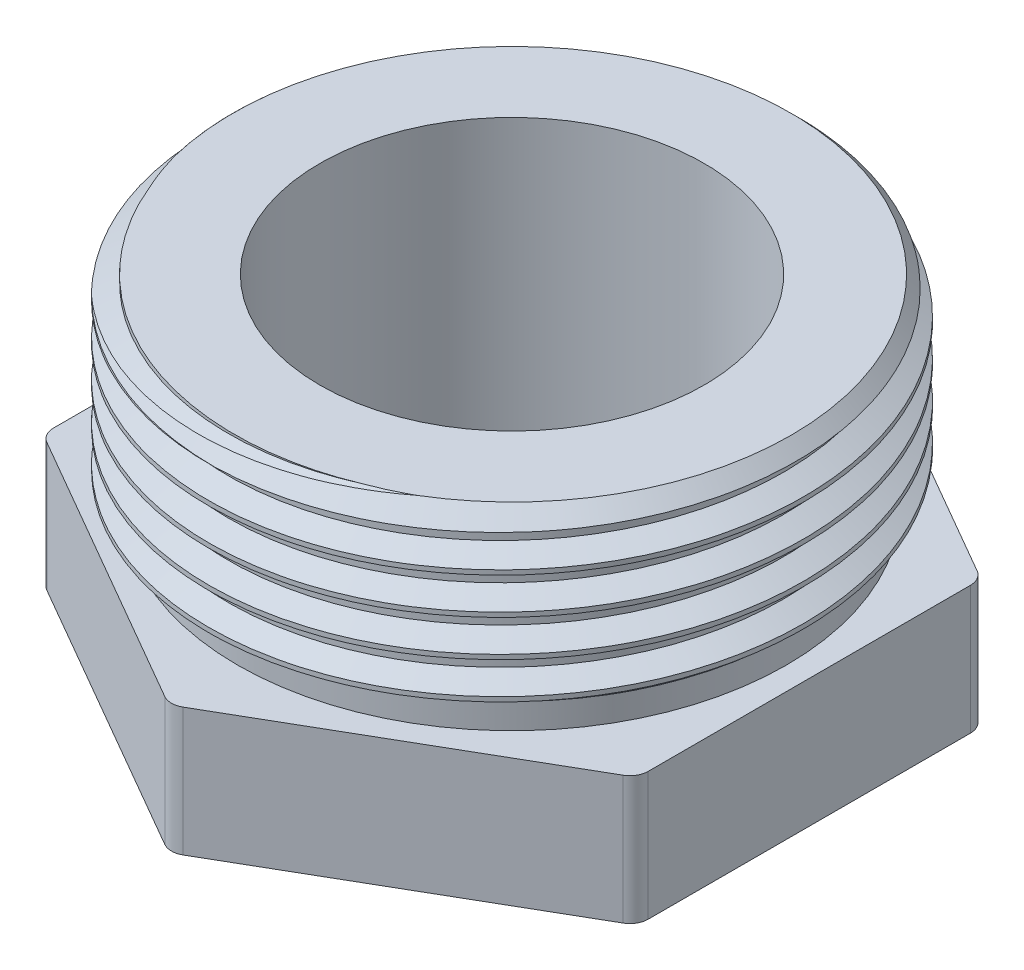
from build123d import *

# Parameters (mm, degrees)
SKETCH1_R           = 21
BOSS_EXTRUDE1_DEPTH = 14
SKETCH2_R           = 30
SKETCH2_R_2         = 21
BOSS_EXTRUDE2_DEPTH = 3
SKETCH3_R           = 32.5
SKETCH3_R_2         = 21
BOSS_EXTRUDE3_DEPTH = 19
CHAMFER1_SIZE       = 2
THREAD1_PITCH       = 4
THREAD1_TO          = 28
FILLET1_R           = 2


with BuildPart() as part:
    # Sketch1 → Boss-Extrude1 (new body)
    with BuildSketch(Plane(origin=(0, 0, 0), x_dir=(1, 0, 0), z_dir=(0, 1, 0))):
        Polygon((0, 37.527767497), (-32.5, 18.763883749), (-32.5, -18.763883749), (0, -37.527767497), (32.5, -18.763883749), (32.5, 18.763883749), align=None)
        with Locations(Location((0, 0, 0), (0, 0, 270))):
            Circle(SKETCH1_R, mode=Mode.SUBTRACT)
    extrude(amount=BOSS_EXTRUDE1_DEPTH)

    # Sketch2 → Boss-Extrude2 (add)
    with BuildSketch(Plane(origin=(0, 14, 0), x_dir=(1, 0, 0), z_dir=(0, 1, 0))):
        with Locations(Location((0, 0, 0), (0, 0, 270))):
            Circle(SKETCH2_R)
        with Locations(Location((0, 0, 0), (0, 0, 270))):
            Circle(SKETCH2_R_2, mode=Mode.SUBTRACT)
    extrude(amount=BOSS_EXTRUDE2_DEPTH)

    # Sketch3 → Boss-Extrude3 (add)
    with BuildSketch(Plane(origin=(0, 17, 0), x_dir=(1, 0, 0), z_dir=(0, 1, 0))):
        with Locations(Location((0, 0, 0), (0, 0, 270))):
            Circle(SKETCH3_R)
        with Locations(Location((0, 0, 0), (0, 0, 270))):
            Circle(SKETCH3_R_2, mode=Mode.SUBTRACT)
    extrude(amount=BOSS_EXTRUDE3_DEPTH)

    # Chamfer1
    chamfer1_edges = [part.edges().sort_by_distance(p)[0] for p in [
        (0, 36, -32.5),
    ]]
    chamfer(chamfer1_edges, length=CHAMFER1_SIZE)

    # Thread1: arcs per turn and ends read off the stored shape
    # Thread1: the profile of Thread Profile1 profile screwed along a right-hand helix through 7.75 turns, 12 arcs to a turn; built about Z, then put on its axis
    thread1_z = Axis((0, 0, 0), (0, 0, 1))
    thread1_corners = [(32.5003, 0, -0.000173205), (32.5003, 0, 3.500173194), (30.3349365, 0, 2.249999995), (30.3349365, 0, 1.249999995)]
    with BuildLine(mode=Mode.PRIVATE) as thread1_profile:
        Line(thread1_corners[0], thread1_corners[1])
        Line(thread1_corners[1], thread1_corners[2])
        Line(thread1_corners[2], thread1_corners[3])
        Line(thread1_corners[3], thread1_corners[0])
    thread1_cap = Face(thread1_profile.wire())
    thread1_turn_angles = [0, 15, 30, 45, 60, 75, 90, 105, 120, 135, 150, 165, 180, 195, 210, 225, 240, 255, 270, 285, 300, 315, 330, 345, 360]
    thread1_turn_weights = [1, 0.9659258262890683, 1, 0.9659258262890683, 1, 0.9659258262890683, 1, 0.9659258262890683, 1, 0.9659258262890683, 1, 0.9659258262890683, 1, 0.9659258262890683, 1, 0.9659258262890683, 1, 0.9659258262890683, 1, 0.9659258262890683, 1, 0.9659258262890683, 1, 0.9659258262890683, 1]
    thread1_turn_rails = [Edge.make_bspline([Vector(p[0], p[1], 0).rotate(thread1_z, thread1_turn_angles[k]) / thread1_turn_weights[k] + Vector(0, 0, p[2] + THREAD1_PITCH * thread1_turn_angles[k] / 360) for k in range(25)], [0, 0, 0, 1, 1, 2, 2, 3, 3, 4, 4, 5, 5, 6, 6, 7, 7, 8, 8, 9, 9, 10, 10, 11, 11, 12, 12, 12], 2, thread1_turn_weights) for p in thread1_corners]
    thread1_turn_sides = [Face.make_surface_from_curves(thread1_turn_rails[p[0]], thread1_turn_rails[p[1]]) for p in [(0, 1), (1, 2), (2, 3), (3, 0)]]
    thread1_last_angles = [2520, 2535, 2550, 2565, 2580, 2595, 2610, 2625, 2640, 2655, 2670, 2685, 2700, 2715, 2730, 2745, 2760, 2775, 2790]
    thread1_last_weights = [1, 0.9659258262890683, 1, 0.9659258262890683, 1, 0.9659258262890683, 1, 0.9659258262890683, 1, 0.9659258262890683, 1, 0.9659258262890683, 1, 0.9659258262890683, 1, 0.9659258262890683, 1, 0.9659258262890683, 1]
    thread1_last_rails = [Edge.make_bspline([Vector(p[0], p[1], 0).rotate(thread1_z, thread1_last_angles[k]) / thread1_last_weights[k] + Vector(0, 0, p[2] + THREAD1_PITCH * thread1_last_angles[k] / 360) for k in range(19)], [0, 0, 0, 1, 1, 2, 2, 3, 3, 4, 4, 5, 5, 6, 6, 7, 7, 8, 8, 9, 9, 9], 2, thread1_last_weights) for p in thread1_corners]
    thread1_last_sides = [Face.make_surface_from_curves(thread1_last_rails[p[0]], thread1_last_rails[p[1]]) for p in [(0, 1), (1, 2), (2, 3), (3, 0)]]
    thread1 = Plane(origin=(0, 45, 0), x_dir=(-1, 0, 0), z_dir=(0, -1, 0)) * split(Solid(Shell([*[p.moved(Location((0, 0, THREAD1_PITCH * i))) for i in range(7) for p in thread1_turn_sides], *thread1_last_sides, thread1_cap, thread1_cap.rotate(thread1_z, 2790).moved(Location((0, 0, THREAD1_PITCH * 2790 / 360)))])), bisect_by=Plane.XY.offset(THREAD1_TO), keep=Keep.BOTTOM, mode=Mode.PRIVATE)
    add(thread1, mode=Mode.SUBTRACT)

    # Fillet1
    fillet1_edges = [part.edges().sort_by_distance(p)[0] for p in [
        (32.5, 7, -18.763883749),
        (32.5, 7, 18.763883749),
        (0, 7, 37.527767497),
        (-32.5, 7, 18.763883749),
        (-32.5, 7, -18.763883749),
        (0, 7, -37.527767497),
    ]]
    fillet(fillet1_edges, radius=FILLET1_R)


solid = part.part
